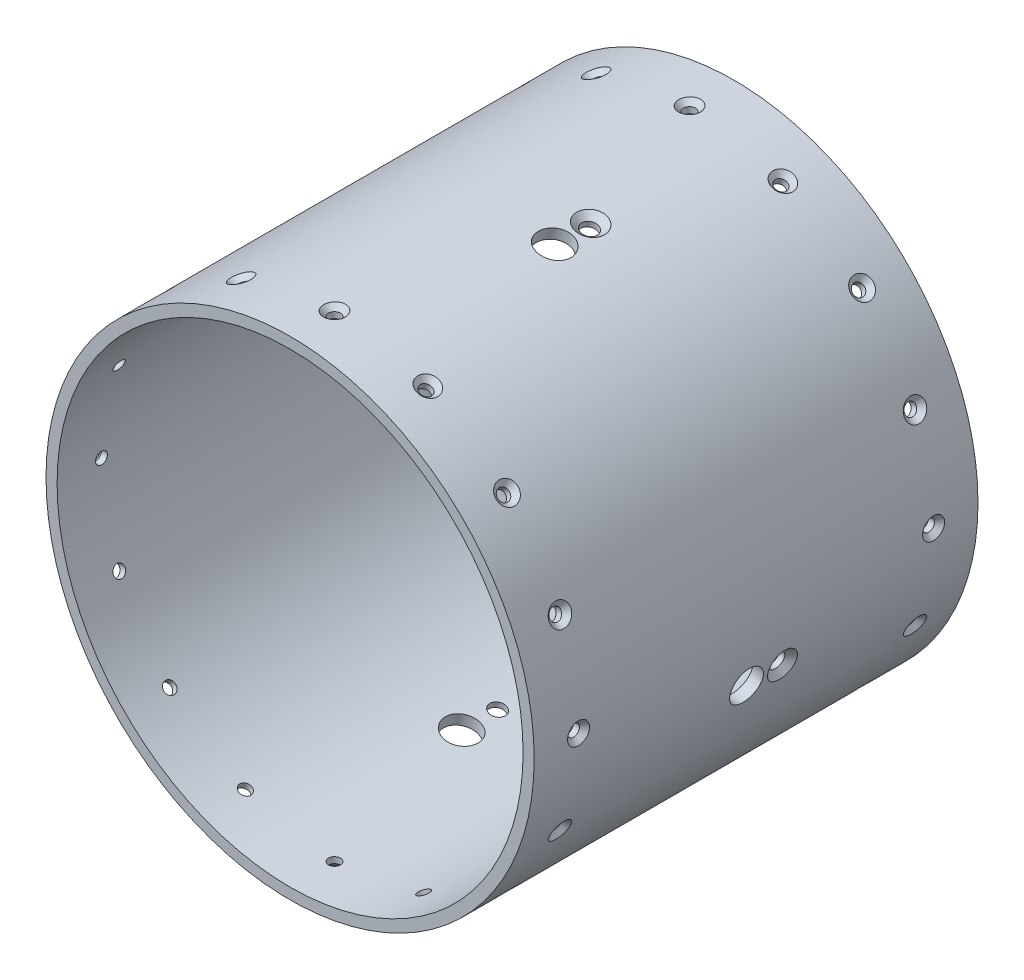
from build123d import *

# Parameters (mm, degrees)
SKETCH1_R                          = 69.85
SKETCH1_R_2                        = 66.675
EXTRUDE1_DEPTH                     = 127
CIRPATTERN1_COUNT                  = 16
CIRPATTERN2_COUNT                  = 4
F_7_16_0_4375_DIAMETER_HOLE1_D     = 11.1125
F_7_16_0_4375_DIAMETER_HOLE1_DEPTH = 9.652
F_7_16_0_4375_DIAMETER_HOLE1_TIP   = 3.338531814


with BuildPart() as part:
    # Sketch1 → Extrude1 (new body)
    with BuildSketch(Plane.XY):
        Circle(SKETCH1_R)
        Circle(SKETCH1_R_2, mode=Mode.SUBTRACT)
    extrude(amount=EXTRUDE1_DEPTH)

    # Sketch12 → CSK for M3 Flat Head Machine Screw2 (revolve, cut)
    with BuildSketch(Plane(origin=(69.85, 0, 114.3), x_dir=(0, 0, -1), z_dir=(0, 1, 0))):
        Polygon((0, 0), (0, 13.213463052), (1.7, 12.192), (1.7, 1.45), (3.15, 0), align=None)
    csk_for_m3_flat_head_machine_screw2 = revolve(axis=Axis((76.2, 0, 114.3), (-1, 0, 0)), mode=Mode.SUBTRACT)

    # Sketch30 → CSK for M3 Flat Head Machine Screw1 (revolve, cut)
    with BuildSketch(Plane(origin=(69.85, 0, 12.7), x_dir=(0, 0, -1), z_dir=(0, 1, 0))):
        Polygon((0, 0), (0, 13.213463052), (1.7, 12.192), (1.7, 1.45), (3.15, 0), align=None)
    csk_for_m3_flat_head_machine_screw1 = revolve(axis=Axis((76.2, 0, 12.7), (-1, 0, 0)), mode=Mode.SUBTRACT)

    # CirPattern1: CSK for M3 Flat Head Machine Screw2, CSK for M3 Flat Head Machine Screw1 ×16 about axis
    cirpattern1_axis = Axis((0, 0, 127), (0, 0, -1))
    add([csk_for_m3_flat_head_machine_screw2.rotate(cirpattern1_axis, i * 360 / CIRPATTERN1_COUNT) for i in range(1, CIRPATTERN1_COUNT)], mode=Mode.SUBTRACT)
    add([csk_for_m3_flat_head_machine_screw1.rotate(cirpattern1_axis, i * 360 / CIRPATTERN1_COUNT) for i in range(1, CIRPATTERN1_COUNT)], mode=Mode.SUBTRACT)

    # Sketch32 → 3/8 (0.375) Diameter Hole1 (revolve, cut)
    with BuildSketch(Plane(origin=(68.507851836, -13.627058993, 64.890747868), x_dir=(0.19509032201612853, 0.9807852804032304, 0), z_dir=(0, 0, 1))):
        Polygon((0, 0), (0, 15.561598698), (4.7625, 12.7), (4.7625, 0), align=None)
    f_3_8_0_375_diameter_hole1 = revolve(axis=Axis((74.735838367, -14.865882538, 64.890747868), (-0.9807852804032304, 0.19509032201612855, 0)), mode=Mode.SUBTRACT)

    # Sketch22 → CSK for #8 Flat Head Machine Screw (100)2 (revolve, cut)
    with BuildSketch(Plane(origin=(68.507851836, -13.627058993, 54.61), x_dir=(0.19509032201612853, 0.9807852804032304, 0), z_dir=(0, 0, 1))):
        Polygon((0, 0), (0, 13.542674586), (2.2479, 12.192), (2.2479, 1.651767624), (4.2164, 0), align=None)
    csk_for_8_flat_head_machine_screw_100 = revolve(axis=Axis((74.735838367, -14.865882538, 54.61), (-0.9807852804032304, 0.19509032201612855, 0)), mode=Mode.SUBTRACT)

    # CirPattern2: 3/8 (0.375) Diameter Hole1, CSK for #8 Flat Head Machine Screw (100)2 ×4 about axis
    cirpattern2_axis = Axis((0, 0, 127), (0, 0, -1))
    add([f_3_8_0_375_diameter_hole1.rotate(cirpattern2_axis, i * 360 / CIRPATTERN2_COUNT) for i in range(1, CIRPATTERN2_COUNT)], mode=Mode.SUBTRACT)
    add([csk_for_8_flat_head_machine_screw_100.rotate(cirpattern2_axis, i * 360 / CIRPATTERN2_COUNT) for i in range(1, CIRPATTERN2_COUNT)], mode=Mode.SUBTRACT)

    # 7/16 (0.4375) Diameter Hole1
    with Locations(Plane(origin=(38.806580776, -58.078152419, 38.1), x_dir=(0.8314696123025465, 0.5555702330196004, 0), z_dir=(0.5555702330196004, -0.8314696123025465, 0))):
        with Locations((0, 0)):
            Hole(F_7_16_0_4375_DIAMETER_HOLE1_D / 2, depth=F_7_16_0_4375_DIAMETER_HOLE1_DEPTH)
            with Locations((0, 0, -(F_7_16_0_4375_DIAMETER_HOLE1_DEPTH + F_7_16_0_4375_DIAMETER_HOLE1_TIP / 2))):  # 118° drill point
                Cone(0, F_7_16_0_4375_DIAMETER_HOLE1_D / 2, F_7_16_0_4375_DIAMETER_HOLE1_TIP, mode=Mode.SUBTRACT)


solid = part.part
